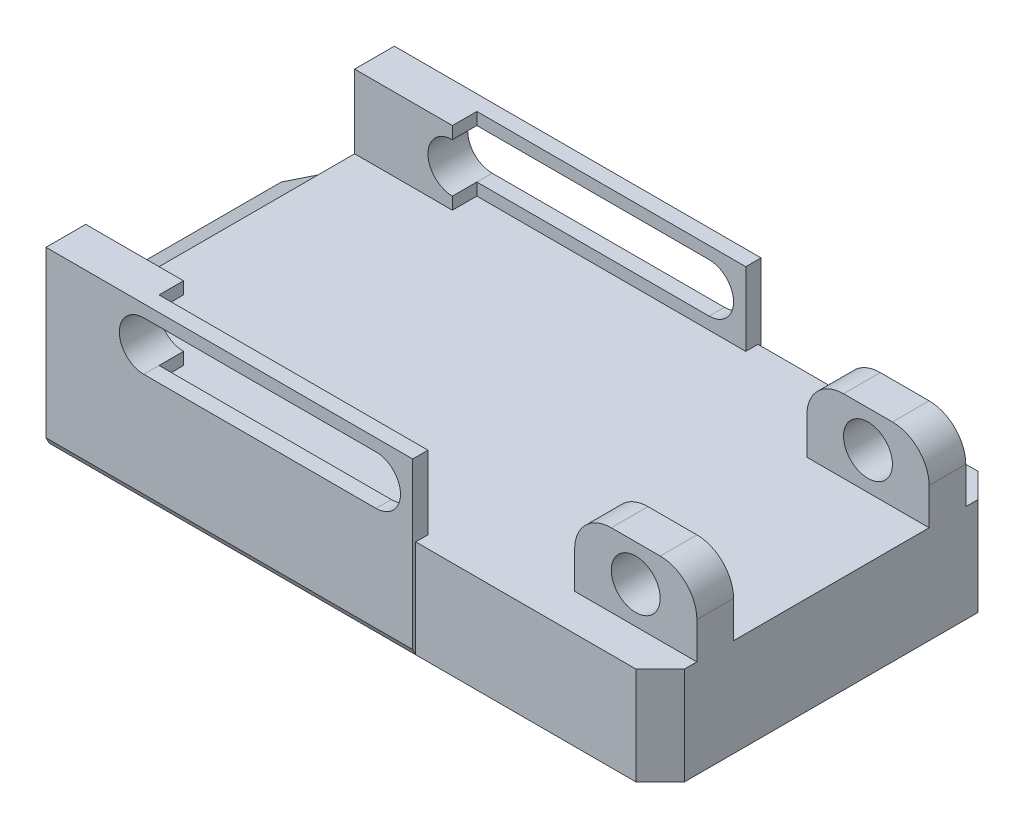
from build123d import *
from build123d.topology import SkipClean

# Parameters (mm, degrees)
SKETCH1_W            = 250
SKETCH1_H            = 140
BOSS_EXTRUDE1_DEPTH  = 10
SKETCH2_W            = 150
SKETCH2_H            = 20
SKETCH2_W_2          = 50
BOSS_EXTRUDE2_DEPTH  = 30
CUT_EXTRUDE1_DEPTH   = 120
SKETCH4_R            = 10
CUT_EXTRUDE2_DEPTH   = 150
SKETCH6_W            = 10
SKETCH6_H            = 40
CUT_EXTRUDE4_DEPTH   = 150
SKETCH7_R            = 10
CUT_EXTRUDE5_DEPTH   = 150
FILLET2_R            = 10
FILLET3_R            = 10
SKETCH13_W           = 50
SKETCH13_H           = 25
SKETCH13_H_2         = 22.244291656
CUT_EXTRUDE6_DEPTH   = 40
SKETCH14_W           = 150
SKETCH14_H           = 30
BOSS_EXTRUDE3_DEPTH  = 10
BOSS_EXTRUDE4_START  = -10
SKETCH16_W           = 150
SKETCH16_H           = 30
BOSS_EXTRUDE4_DEPTH  = 10
SKETCH17_W           = 10
SKETCH17_H           = 30
BOSS_EXTRUDE5_DEPTH  = 50
CUT_EXTRUDE7_START   = -150
SKETCH18_R           = 10
CUT_EXTRUDE7_DEPTH   = 150
SKETCH19_W           = 163.570579747
SKETCH19_H           = 99.685934981
SKETCH19_W_2         = 64.103217044
SKETCH19_H_2         = 29.878618113
SKETCH19_W_3         = 86.104744928
SKETCH19_H_3         = 39.38545115
SKETCH19_W_4         = 22.687824792
SKETCH19_H_4         = 45.375649583
CUT_EXTRUDE8_DEPTH   = 150
BOSS_EXTRUDE6_DEPTH  = 30
BOSS_EXTRUDE8_START  = 20
SKETCH21_W           = 50
SKETCH21_H           = 30
SKETCH21_R           = 10
BOSS_EXTRUDE8_DEPTH  = 20
SKETCH22_W           = 50
SKETCH22_H           = 30
SKETCH22_R           = 10
BOSS_EXTRUDE9_DEPTH  = 20
BOSS_EXTRUDE10_START = 20
SKETCH23_W           = 150
SKETCH23_H           = 30
BOSS_EXTRUDE10_DEPTH = 20
SKETCH24_W           = 150
SKETCH24_H           = 30
BOSS_EXTRUDE11_DEPTH = 20
BOSS_EXTRUDE12_DEPTH = 150
SKETCH27_W           = 150
SKETCH27_H           = 5
CUT_EXTRUDE10_DEPTH  = 40
CUT_EXTRUDE11_REACH  = 270.701
SKETCH28_W           = 27.40328495
SKETCH28_H           = 74.426737968
SKETCH28_W_2         = 23.413674561
SKETCH28_H_2         = 78.651031322
SKETCH29_W           = 80
SKETCH29_H           = 10
BOSS_EXTRUDE13_DEPTH = 15
CUT_EXTRUDE12_DEPTH  = 80
SKETCH40_W           = 150
SKETCH40_H           = 6.25
CUT_EXTRUDE16_DEPTH  = 200
CHAMFER1_SIZE        = 10
FILLET6_R            = 15
CHAMFER2_SIZE        = 20
FILLET7_R            = 15
SKETCH41_W           = 80
SKETCH41_H           = 30
CUT_EXTRUDE18_DEPTH  = 200
BOSS_EXTRUDE16_START = 10
BOSS_EXTRUDE16_DEPTH = 10
BOSS_EXTRUDE17_DEPTH = 10


with BuildPart() as part:
    # Sketch1 → Boss-Extrude1 (new body)
    with BuildSketch(Plane(origin=(0, 0, 0), x_dir=(1, 0, 0), z_dir=(0, 1, 0))):
        Rectangle(SKETCH1_W, SKETCH1_H)
    extrude(amount=BOSS_EXTRUDE1_DEPTH)

    # Sketch2 → Boss-Extrude2 (add)
    with BuildSketch(Plane(origin=(0, 10, 0), x_dir=(1, 0, 0), z_dir=(0, 1, 0))):
        with Locations((-50, 35)):
            Rectangle(SKETCH2_W, SKETCH2_H)
        with Locations((-50, -35)):
            Rectangle(SKETCH2_W, SKETCH2_H)
        Polygon((125, -20), (125, 0), (125, 20), (105, 20), (105, -20), align=None)
        with Locations((100, 60)):
            Rectangle(SKETCH2_W_2, SKETCH2_H)
        with Locations((100, -60)):
            Rectangle(SKETCH2_W_2, SKETCH2_H)
    extrude(amount=BOSS_EXTRUDE2_DEPTH)

    # Sketch3 → Cut-Extrude1 (cut)
    with BuildSketch(Plane.XY.offset(45)):
        with BuildLine():
            Line((10, 35), (-110, 35))
            ThreePointArc((-110, 35), (-120, 25), (-110, 15))
            Line((-110, 15), (10, 15))
            ThreePointArc((10, 15), (20, 25), (10, 35))
        make_face()
    extrude(amount=-CUT_EXTRUDE1_DEPTH, mode=Mode.SUBTRACT)

    # Sketch4 → Cut-Extrude2 (cut)
    with BuildSketch(Plane.XY.offset(70)):
        with Locations((100, 25)):
            Circle(SKETCH4_R)
    extrude(amount=-CUT_EXTRUDE2_DEPTH, mode=Mode.SUBTRACT)

    # Sketch6 → Cut-Extrude4 (cut)
    with BuildSketch(Plane(origin=(0, 10, 0), x_dir=(1, 0, 0), z_dir=(0, 1, 0))):
        with Locations((110, 0)):
            Rectangle(SKETCH6_W, SKETCH6_H)
    extrude(amount=CUT_EXTRUDE4_DEPTH, mode=Mode.SUBTRACT)

    # Sketch7 → Cut-Extrude5 (cut)
    with BuildSketch(Plane(origin=(125, 0, 0), x_dir=(0, 0, -1), z_dir=(1, 0, 0))):
        with Locations((0, 25)):
            Circle(SKETCH7_R)
    extrude(amount=-CUT_EXTRUDE5_DEPTH, mode=Mode.SUBTRACT)

    # Fillet2
    fillet2_edges = [part.edges().sort_by_distance(p)[0] for p in [
        (120, 40, 20),
        (120, 40, -20),
    ]]
    fillet(fillet2_edges, radius=FILLET2_R)

    # Fillet3
    fillet3_edges = [part.edges().sort_by_distance(p)[0] for p in [
        (75, 40, -60),
        (125, 40, -60),
        (75, 40, 60),
        (125, 40, 60),
    ]]
    fillet(fillet3_edges, radius=FILLET3_R)

    # Sketch13 → Cut-Extrude6 (cut)
    with BuildSketch(Plane(origin=(0, 10, 0), x_dir=(1, 0, 0), z_dir=(0, 1, 0))):
        with Locations((100, 47.5)):
            Rectangle(SKETCH13_W, SKETCH13_H)
        with Locations((100, -48.877854172)):
            Rectangle(SKETCH13_W, SKETCH13_H_2)
    extrude(amount=CUT_EXTRUDE6_DEPTH, mode=Mode.SUBTRACT)

    # Sketch14 → Boss-Extrude3 (add)
    with BuildSketch(Plane.XY.offset(70)):
        with Locations((-50, 25)):
            Rectangle(SKETCH14_W, SKETCH14_H)
        with BuildLine():
            Line((10, 35), (-85, 35))
            ThreePointArc((-85, 35), (-95, 25), (-85, 15))
            Line((-85, 15), (10, 15))
            ThreePointArc((10, 15), (20, 25), (10, 35))
        make_face(mode=Mode.SUBTRACT)
    extrude(amount=-BOSS_EXTRUDE3_DEPTH)

    # Sketch16 → Boss-Extrude4 (add)
    with BuildSketch(Plane(origin=(0, 0, -70), x_dir=(-1, 0, 0), z_dir=(0, 0, -1)).offset(BOSS_EXTRUDE4_START)):
        with Locations((50, 25)):
            Rectangle(SKETCH16_W, SKETCH16_H)
        with BuildLine():
            Line((85, 35), (-10, 35))
            ThreePointArc((-10, 35), (-20, 25), (-10, 15))
            Line((-10, 15), (85, 15))
            ThreePointArc((85, 15), (95, 25), (85, 35))
        make_face(mode=Mode.SUBTRACT)
    extrude(amount=BOSS_EXTRUDE4_DEPTH)

    # Sketch17 → Boss-Extrude5 (add)
    with BuildSketch(Plane(origin=(125, 0, 0), x_dir=(0, 0, -1), z_dir=(1, 0, 0))):
        with Locations((30, 25)):
            Rectangle(SKETCH17_W, SKETCH17_H)
        with Locations((-30, 25)):
            Rectangle(SKETCH17_W, SKETCH17_H)
    extrude(amount=-BOSS_EXTRUDE5_DEPTH)

    # Sketch18 → Cut-Extrude7 (cut)
    with BuildSketch(Plane(origin=(0, 0, -70), x_dir=(-1, 0, 0), z_dir=(0, 0, -1)).offset(CUT_EXTRUDE7_START)):
        with Locations(Location((-100, 25, 0), (0, 0, 180))):
            Circle(SKETCH18_R)
    extrude(amount=CUT_EXTRUDE7_DEPTH, mode=Mode.SUBTRACT)

    # Sketch19 → Cut-Extrude8 (cut)
    with BuildSketch(Plane(origin=(0, 10, 0), x_dir=(1, 0, 0), z_dir=(0, 1, 0))):
        with Locations((-43.214710127, 0.1358119)):
            Rectangle(SKETCH19_W, SKETCH19_H)
        with Locations((99.142687378, 64.918088447)):
            Rectangle(SKETCH19_W_2, SKETCH19_H_2)
        with Locations((110.14345132, -67.226890756)):
            Rectangle(SKETCH19_W_3, SKETCH19_H_3)
        with Locations((124.2319325, 0.52597354)):
            Rectangle(SKETCH19_W_4, SKETCH19_H_4)
    extrude(amount=CUT_EXTRUDE8_DEPTH, mode=Mode.SUBTRACT)

    # Sketch20 → Boss-Extrude6 (add)
    with BuildSketch(Plane.XZ):
        Polygon((-125, 40), (-125, 70), (125, 70), (125, -70), (-125, -70), (-125, -40), (-120, -40), (-120, -65), (120, -65), (120, 65), (-120, 65), (-120, 40), align=None)
    extrude(amount=BOSS_EXTRUDE6_DEPTH)

    # Sketch21 → Boss-Extrude8 (add)
    with SkipClean():  # the faces are left unmerged after this step: merging them gives an invalid solid
        with BuildSketch(Plane.XY.offset(35).offset(BOSS_EXTRUDE8_START)):
            with Locations((100, 25)):
                Rectangle(SKETCH21_W, SKETCH21_H)
            with Locations(Location((100, 25, 0), (0, 0, 180))):
                Circle(SKETCH21_R, mode=Mode.SUBTRACT)
        extrude(amount=-BOSS_EXTRUDE8_DEPTH)

    # Sketch22 → Boss-Extrude9 (add)
    with SkipClean():  # the faces are left unmerged after this step: merging them gives an invalid solid
        with BuildSketch(Plane(origin=(0, 0, -35), x_dir=(-1, 0, 0), z_dir=(0, 0, -1))):
            with Locations((-100, 25)):
                Rectangle(SKETCH22_W, SKETCH22_H)
            with Locations((-100, 25)):
                Circle(SKETCH22_R, mode=Mode.SUBTRACT)
        extrude(amount=BOSS_EXTRUDE9_DEPTH)

    # Sketch23 → Boss-Extrude10 (add)
    with SkipClean():  # the faces are left unmerged after this step: merging them gives an invalid solid
        with BuildSketch(Plane.XY.offset(70).offset(BOSS_EXTRUDE10_START)):
            with Locations((-50, 25)):
                Rectangle(SKETCH23_W, SKETCH23_H)
            with BuildLine():
                Line((10, 35), (-85, 35))
                ThreePointArc((-85, 35), (-95, 25), (-85, 15))
                Line((-85, 15), (10, 15))
                ThreePointArc((10, 15), (20, 25), (10, 35))
            make_face(mode=Mode.SUBTRACT)
        extrude(amount=-BOSS_EXTRUDE10_DEPTH)

    # Sketch24 → Boss-Extrude11 (add)
    with SkipClean():  # the faces are left unmerged after this step: merging them gives an invalid solid
        with BuildSketch(Plane(origin=(0, 0, -70), x_dir=(-1, 0, 0), z_dir=(0, 0, -1))):
            with Locations((50, 25)):
                Rectangle(SKETCH24_W, SKETCH24_H)
            with BuildLine():
                Line((-10, 35), (85, 35))
                ThreePointArc((85, 35), (95, 25), (85, 15))
                Line((85, 15), (-10, 15))
                ThreePointArc((-10, 15), (-20, 25), (-10, 35))
            make_face(mode=Mode.SUBTRACT)
        extrude(amount=BOSS_EXTRUDE11_DEPTH)

    # Sketch26 → Boss-Extrude12 (add)
    with SkipClean():  # the faces are left unmerged after this step: merging them gives an invalid solid
        with BuildSketch(Plane(origin=(25, 0, 0), x_dir=(0, 0, -1), z_dir=(1, 0, 0))):
            Polygon((70, -30), (90, 10), (70, 10), align=None)
            Polygon((-90, 10), (-70, 10), (-70, -30), align=None)
        extrude(amount=-BOSS_EXTRUDE12_DEPTH)

    # Sketch27 → Cut-Extrude10 (cut)
    with SkipClean():  # the faces are left unmerged after this step: merging them gives an invalid solid
        with BuildSketch(Plane(origin=(0, 10, 0), x_dir=(1, 0, 0), z_dir=(0, 1, 0))):
            with Locations((-50, 62.5)):
                Rectangle(SKETCH27_W, SKETCH27_H)
            with Locations((-50, -62.5)):
                Rectangle(SKETCH27_W, SKETCH27_H)
        extrude(amount=CUT_EXTRUDE10_DEPTH, mode=Mode.SUBTRACT)

    # Cut-Extrude11: up to this face of the body (flat: up to its plane)
    cut_extrude11_end = Plane(part.part.faces().sort_by_distance((25, 25, -80))[0])
    # Sketch28 → Cut-Extrude11 (cut, up to the picked face)
    with BuildSketch(Plane.ZY.offset(125), mode=Mode.PRIVATE) as cut_extrude11_sk1:
        with Locations((-91.201642475, 2.786631016)):
            Rectangle(SKETCH28_W, SKETCH28_H)
    cut_extrude11_tool1 = split(extrude(cut_extrude11_sk1.sketch, amount=-CUT_EXTRUDE11_REACH, mode=Mode.PRIVATE), bisect_by=cut_extrude11_end, keep=Keep.BOTH, mode=Mode.PRIVATE)
    # Sketch28 → Cut-Extrude11 (cut, up to the picked face)
    with BuildSketch(Plane.ZY.offset(125), mode=Mode.PRIVATE) as cut_extrude11_sk2:
        with Locations((89.20683728, 0.674484339)):
            Rectangle(SKETCH28_W_2, SKETCH28_H_2)
    cut_extrude11_tool2 = split(extrude(cut_extrude11_sk2.sketch, amount=-CUT_EXTRUDE11_REACH, mode=Mode.PRIVATE), bisect_by=cut_extrude11_end, keep=Keep.BOTH, mode=Mode.PRIVATE)
    add(cut_extrude11_tool1.solids().sort_by(Axis((-125, 2.786631, -91.201642), (1, 0, 0)))[0], mode=Mode.SUBTRACT)
    add(cut_extrude11_tool2.solids().sort_by(Axis((-125, 0.674484, 89.206837), (1, 0, 0)))[0], mode=Mode.SUBTRACT)

    # Sketch29 → Boss-Extrude13 (add)
    with SkipClean():  # the faces are left unmerged after this step: merging them gives an invalid solid
        with BuildSketch(Plane.ZY.offset(125)):
            with Locations((0, 5)):
                Rectangle(SKETCH29_W, SKETCH29_H)
        extrude(amount=BOSS_EXTRUDE13_DEPTH)

    # Sketch31 → Cut-Extrude12 (cut)
    with SkipClean():  # the faces are left unmerged after this step: merging them gives an invalid solid
        with BuildSketch(Plane.XY.offset(40)):
            Polygon((-140, 0), (-125, 10), (-140, 10), align=None)
        extrude(amount=-CUT_EXTRUDE12_DEPTH, mode=Mode.SUBTRACT)

    # Sketch40 → Cut-Extrude16 (cut)
    with SkipClean():  # the faces are left unmerged after this step: merging them gives an invalid solid
        with BuildSketch(Plane(origin=(0, 40, 0), x_dir=(1, 0, 0), z_dir=(0, 1, 0))):
            with Locations((-50, 74.375)):
                Rectangle(SKETCH40_W, SKETCH40_H)
            with Locations((-50, -74.375)):
                Rectangle(SKETCH40_W, SKETCH40_H)
        extrude(amount=-CUT_EXTRUDE16_DEPTH, mode=Mode.SUBTRACT)

    # Chamfer1
    chamfer1_edges = [part.edges().sort_by_distance(p)[0] for p in [
        (125, -10, 70),
        (125, -10, -70),
    ]]
    chamfer(chamfer1_edges, length=CHAMFER1_SIZE - 0.0001)  # a hair under: the kernel refuses the full size

    # Fillet6
    fillet6_edges = [part.edges().sort_by_distance(p)[0] for p in [
        (75, 40, -40),
        (125, 40, -40),
        (75, 40, 40),
        (125, 40, 40),
    ]]
    fillet(fillet6_edges, radius=FILLET6_R)

    # Chamfer2
    chamfer2_edges = [part.edges().sort_by_distance(p)[0] for p in [
        (-122.5, -30, 40),
        (-122.5, -30, -40),
    ]]
    chamfer(chamfer2_edges, length=CHAMFER2_SIZE)

    # Fillet7
    fillet7_edges = [part.edges().sort_by_distance(p)[0] for p in [
        (120, -15, 65),
        (120, -15, -65),
    ]]
    fillet(fillet7_edges, radius=FILLET7_R)

    # Sketch41 → Cut-Extrude18 (cut)
    with BuildSketch(Plane.ZY.offset(-75)):
        with Locations((0, 25)):
            Rectangle(SKETCH41_W, SKETCH41_H)
    extrude(amount=-CUT_EXTRUDE18_DEPTH, mode=Mode.SUBTRACT)

    # Sketch42 → Boss-Extrude16 (add)
    with BuildSketch(Plane.XY.offset(-65).offset(BOSS_EXTRUDE16_START)):
        with BuildLine():
            Line((-85, 35), (-85, 40))
            Line((-85, 40), (-125, 40))
            Line((-125, 40), (-125, 10))
            Line((-125, 10), (-85, 10))
            Line((-85, 10), (-85, 15))
            ThreePointArc((-85, 15), (-95, 25), (-85, 35))
        make_face()
    extrude(amount=-BOSS_EXTRUDE16_DEPTH)

    # Sketch43 → Boss-Extrude17 (add)
    with BuildSketch(Plane(origin=(0, 0, 65), x_dir=(-1, 0, 0), z_dir=(0, 0, -1))):
        with BuildLine():
            Line((85, 35), (85, 40))
            Line((85, 40), (125, 40))
            Line((125, 40), (125, 10))
            Line((125, 10), (85, 10))
            Line((85, 10), (85, 15))
            ThreePointArc((85, 15), (95, 25), (85, 35))
        make_face()
    extrude(amount=BOSS_EXTRUDE17_DEPTH)


solid = part.part
